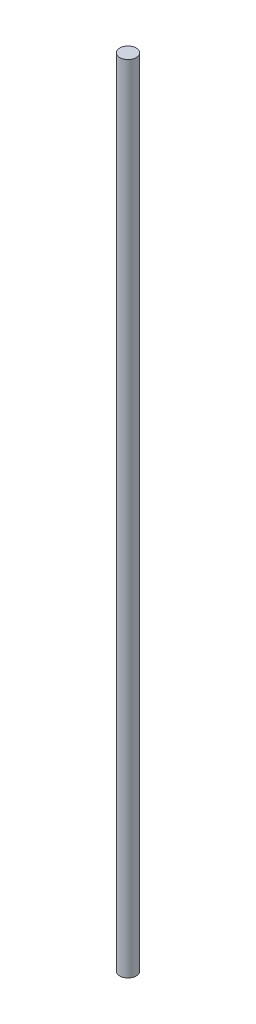
from build123d import *

# Parameters (mm, degrees)
SKETCH1_R           = 6.35
BOSS_EXTRUDE1_DEPTH = 609.6


with BuildPart() as part:
    # Sketch1 → Boss-Extrude1 (new body)
    with BuildSketch(Plane(origin=(0, 0, 0), x_dir=(1, 0, 0), z_dir=(0, 1, 0))):
        Circle(SKETCH1_R)
    extrude(amount=BOSS_EXTRUDE1_DEPTH)


solid = part.part
